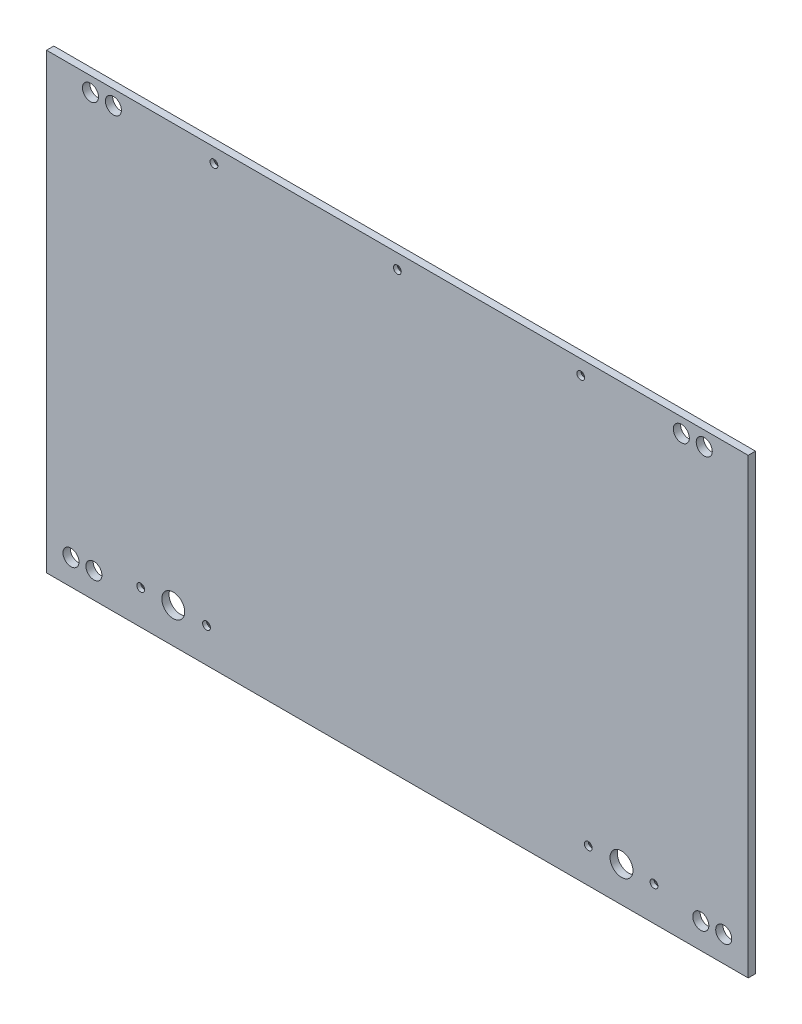
from build123d import *

# Parameters (mm, degrees)
SKETCH1_W                                       = 306.05
SKETCH1_H                                       = 197.425
BOSS_EXTRUDE1_DEPTH                             = 3.175
SKETCH2_R                                       = 5
CUT_EXTRUDE1_DEPTH                              = 183.128770122
SKETCH3_R                                       = 3.5
CUT_EXTRUDE2_DEPTH                              = 183.128770122
CSK_FOR_M3_FLAT_HEAD_MACHINE_SCREW1_D           = 3.4
CSK_FOR_M3_FLAT_HEAD_MACHINE_SCREW1_CSINK_D     = 6.3
CSK_FOR_M3_FLAT_HEAD_MACHINE_SCREW1_CSINK_ANGLE = 90


with BuildPart() as part:
    # Sketch1 → Boss-Extrude1 (new body)
    with BuildSketch(Plane.XY):
        Rectangle(SKETCH1_W, SKETCH1_H)
    extrude(amount=BOSS_EXTRUDE1_DEPTH)

    # Sketch2 → Cut-Extrude1 (cut, through all)
    with BuildSketch(Plane(origin=(0, 0, 0), x_dir=(-1, 0, 0), z_dir=(0, 0, -1))):
        with Locations((-97.75, -83.334)):
            Circle(SKETCH2_R)
    cut_extrude1 = extrude(amount=-CUT_EXTRUDE1_DEPTH, mode=Mode.SUBTRACT)

    # Mirror1: Cut-Extrude1 across plane
    add(cut_extrude1.mirror(Plane(origin=(0, 0, 0), x_dir=(0, 0, 1), z_dir=(1, 0, 0))), mode=Mode.SUBTRACT)

    # Sketch3 → Cut-Extrude2 (cut, through all)
    with BuildSketch(Plane(origin=(0, 0, 0), x_dir=(-1, 0, 0), z_dir=(0, 0, -1))):
        with Locations((-123.850000066, 92.3625)):
            Circle(SKETCH3_R)
        with Locations((-133.850000066, 92.3625)):
            Circle(SKETCH3_R)
        with Locations((-132.350000066, -87.5375001)):
            Circle(SKETCH3_R)
        with Locations((-142.350000066, -87.5375001)):
            Circle(SKETCH3_R)
    cut_extrude2 = extrude(amount=-CUT_EXTRUDE2_DEPTH, mode=Mode.SUBTRACT)

    # CSK for M3 Flat Head Machine Screw1 (through all)
    with Locations(Plane(origin=(0, 0, 0), x_dir=(-1, 0, 0), z_dir=(0, 0, -1))):
        with Locations((-111.94, -83.7125), (-83.25, -83.7125), (-80, 92.3625), (0, 92.3625)):
            csk_for_m3_flat_head_machine_screw1 = CounterSinkHole(CSK_FOR_M3_FLAT_HEAD_MACHINE_SCREW1_D / 2, CSK_FOR_M3_FLAT_HEAD_MACHINE_SCREW1_CSINK_D / 2, counter_sink_angle=CSK_FOR_M3_FLAT_HEAD_MACHINE_SCREW1_CSINK_ANGLE)

    # Mirror2: Cut-Extrude2, CSK for M3 Flat Head Machine Screw1 across plane
    add(cut_extrude2.mirror(Plane(origin=(0, 0, 0), x_dir=(0, 0, 1), z_dir=(1, 0, 0))), mode=Mode.SUBTRACT)
    add(csk_for_m3_flat_head_machine_screw1.mirror(Plane(origin=(0, 0, 0), x_dir=(0, 0, 1), z_dir=(1, 0, 0))), mode=Mode.SUBTRACT)


solid = part.part
